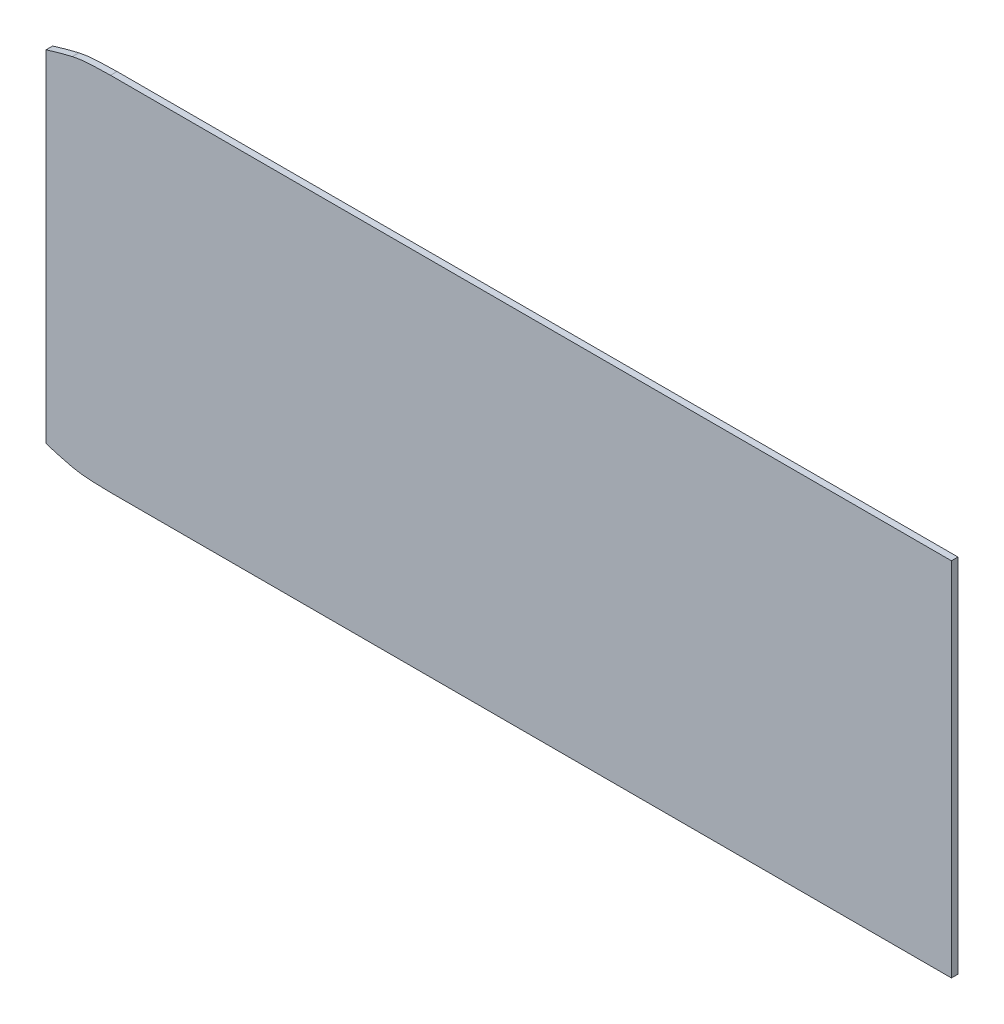
from build123d import *

# Parameters (mm, degrees)
SKETCH1_W                   = 416
SKETCH1_H                   = 166
BOSS_EXTRUDE1_DEPTH         = 3
CUT_EXTRUDE_THIN3_OUTLINE_W = 0.015995157
CUT_EXTRUDE_THIN3_OUTLINE_H = 166
CUT_EXTRUDE_THIN3_DEPTH     = 3


# Read off the part's stored shape, not the designer's step: Cut-Extrude-Thin3
with BuildPart() as part:
    # Sketch1 → Boss-Extrude1 (new body)
    with BuildSketch(Plane.XY):
        with Locations((-50, 0)):
            Rectangle(SKETCH1_W, SKETCH1_H)
    extrude(amount=BOSS_EXTRUDE1_DEPTH)

    # Cut-Extrude-Thin3 outline → Cut-Extrude-Thin3 (cut)
    with BuildSketch(Plane.XY):
        with BuildLine():
            add(Edge.make_bspline(
                [(-245.900726071, 81.670126669), (-248.205217512, 81.122650851), (-250.502051759, 80.533244416), (-253.933177983, 79.571844696), (-255.074519046, 79.238452038), (-256.809467384, 78.708399189), (-257.40527654, 78.522165432), (-258, 78.331788106)],
                knots=[-1.118e-06, -1.118e-06, -1.118e-06, -1.118e-06, 0.125, 0.125, 0.1875, 0.1875, 0.220226879, 0.220226879, 0.220226879, 0.220226879], degree=3))
            add(Edge.make_bspline(
                [(-228.373898498, 82.999999879), (-229.840089175, 82.999940695), (-231.305822798, 82.978130365), (-234.23846503, 82.898798217), (-235.705718536, 82.841217903), (-238.636271152, 82.67124962), (-240.100674412, 82.559518263), (-242.288562974, 82.310467536), (-243.016587256, 82.213409792), (-244.465500098, 81.977984668), (-245.186104013, 81.839884091), (-245.900726071, 81.670126669)],
                knots=[0.000327866, 0.000327866, 0.000327866, 0.000327866, 0.25, 0.25, 0.5, 0.5, 0.75, 0.75, 0.875, 0.875, 1, 1, 1, 1], degree=3))
            Line((-228.373898498, 82.999999879), (-258, 83))
            Line((-258, 83), (-258, 78.331788106))
        make_face()
        with BuildLine():
            add(Edge.make_bspline(
                [(-258.00000599, -78.331863791), (-256.278252152, -78.883088593), (-254.549713484, -79.39880324), (-250.534508221, -80.524590275), (-248.243697449, -81.112973045), (-245.944918928, -81.659654554)],
                knots=[0.779967806, 0.779967806, 0.779967806, 0.779967806, 0.875, 0.875, 1, 1, 1, 1], degree=3))
            Line((-258.00000599, -78.331863791), (-258, -83))
            Line((-258, -83), (-228.371279881, -83))
            add(Edge.make_bspline(
                [(-245.944918928, -81.659654554), (-245.228204163, -81.83008772), (-244.504823749, -81.968976927), (-243.051197688, -82.205725268), (-242.321772562, -82.303279617), (-240.128214471, -82.554030513), (-238.659345658, -82.66691784), (-235.722483002, -82.838682109), (-234.252964152, -82.897051002), (-231.31301555, -82.977668647), (-229.842588562, -82.999987305), (-228.371279881, -83)],
                knots=[-4.074e-06, -4.074e-06, -4.074e-06, -4.074e-06, 0.125, 0.125, 0.25, 0.25, 0.5, 0.5, 0.75, 0.75, 0.999912213, 0.999912213, 0.999912213, 0.999912213], degree=3))
        make_face()
        with Locations((157.992002421, 0)):
            Rectangle(CUT_EXTRUDE_THIN3_OUTLINE_W, CUT_EXTRUDE_THIN3_OUTLINE_H)
    extrude(amount=CUT_EXTRUDE_THIN3_DEPTH, mode=Mode.SUBTRACT)


solid = part.part
